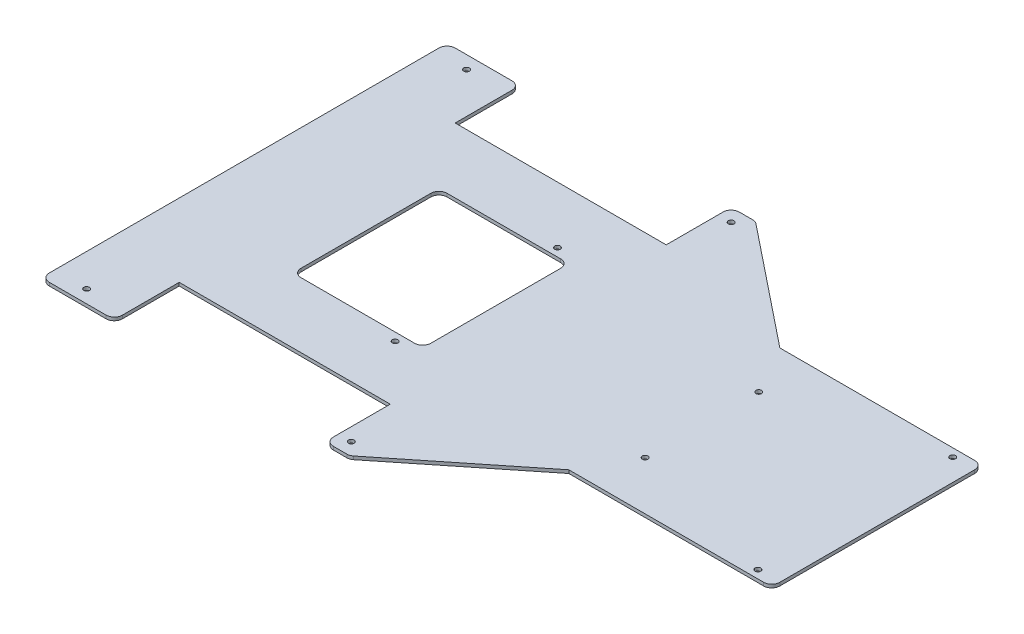
from build123d import *

# Parameters (mm, degrees)
SKETCH_1_W          = 390
SKETCH_1_H          = 250
EXTRUDE_1_DEPTH     = 2
SKETCH_2_W          = 125
SKETCH_2_H          = 60
SKETCH_2_W_2        = 130
SKETCH_2_H_2        = 40
CUT_EXTRUDE_1_DEPTH = 10
CUT_EXTRUDE_2_DEPTH = 10
FILLET_1_R          = 5
SKETCH_4_W          = 80
SKETCH_4_H          = 90
CUT_EXTRUDE_3_DEPTH = 232.633330935
FILLET_2_R          = 5
SKETCH_5_R          = 1.75
CUT_EXTRUDE_4_DEPTH = 232.633330935


with BuildPart() as part:
    # 스케치1 → 보스-돌출1 (new body)
    with BuildSketch(Plane(origin=(0, 0, 0), x_dir=(1, 0, 0), z_dir=(0, 1, 0))):
        Rectangle(SKETCH_1_W, SKETCH_1_H)
    extrude(amount=EXTRUDE_1_DEPTH)

    # 스케치2 → 컷-돌출1 (cut)
    with BuildSketch(Plane(origin=(0, 2, 0), x_dir=(1, 0, 0), z_dir=(0, 1, 0))):
        with Locations((132.5, 95)):
            Rectangle(SKETCH_2_W, SKETCH_2_H)
        with Locations((132.5, -95)):
            Rectangle(SKETCH_2_W, SKETCH_2_H)
        with Locations((-85, 105)):
            Rectangle(SKETCH_2_W_2, SKETCH_2_H_2)
        with Locations((-85, -105)):
            Rectangle(SKETCH_2_W_2, SKETCH_2_H_2)
    extrude(amount=-CUT_EXTRUDE_1_DEPTH, mode=Mode.SUBTRACT)

    # 스케치3 → 컷-돌출2 (cut)
    with BuildSketch(Plane(origin=(0, 2, 0), x_dir=(1, 0, 0), z_dir=(0, 1, 0))):
        Polygon((-5, 125), (70, 65), (70, 125), align=None)
        Polygon((-5, -125), (70, -65), (70, -125), align=None)
    extrude(amount=-CUT_EXTRUDE_2_DEPTH, mode=Mode.SUBTRACT)

    # 필렛1
    fillet_1_edges = [part.edges().sort_by_distance(p)[0] for p in [
        (-5, 1, 125),
        (-5, 1, -125),
        (-20, 1, -125),
        (-20, 1, 125),
        (195, 1, 65),
        (195, 1, -65),
        (-150, 1, -125),
        (-150, 1, 125),
        (-195, 1, 125),
        (-195, 1, -125),
    ]]
    fillet(fillet_1_edges, radius=FILLET_1_R)

    # 스케치4 → 컷-돌출3 (cut, through all)
    with BuildSketch(Plane(origin=(0, 2, 0), x_dir=(1, 0, 0), z_dir=(0, 1, 0))):
        with Locations((-80, 0)):
            Rectangle(SKETCH_4_W, SKETCH_4_H)
    extrude(amount=-CUT_EXTRUDE_3_DEPTH, mode=Mode.SUBTRACT)

    # 필렛2
    fillet_2_edges = [part.edges().sort_by_distance(p)[0] for p in [
        (-120, 1, 45),
        (-40, 1, 45),
        (-40, 1, -45),
        (-120, 1, -45),
    ]]
    fillet(fillet_2_edges, radius=FILLET_2_R)

    # 스케치5 → 컷-돌출4 (cut, through all)
    with BuildSketch(Plane(origin=(0, 2, 0), x_dir=(1, 0, 0), z_dir=(0, 1, 0))):
        with Locations((-12, 117)):
            Circle(SKETCH_5_R)
        with Locations((-12, -117)):
            Circle(SKETCH_5_R)
        with Locations((181.5, 60)):
            Circle(SKETCH_5_R)
        with Locations((181.5, -60)):
            Circle(SKETCH_5_R)
        with Locations((-175, 117)):
            Circle(SKETCH_5_R)
        with Locations((-175, -117)):
            Circle(SKETCH_5_R)
        with Locations((87, 35)):
            Circle(SKETCH_5_R)
        with Locations((87, -35)):
            Circle(SKETCH_5_R)
        with Locations((-52, 50)):
            Circle(SKETCH_5_R)
        with Locations((-52, -50)):
            Circle(SKETCH_5_R)
    extrude(amount=-CUT_EXTRUDE_4_DEPTH, mode=Mode.SUBTRACT)


solid = part.part
